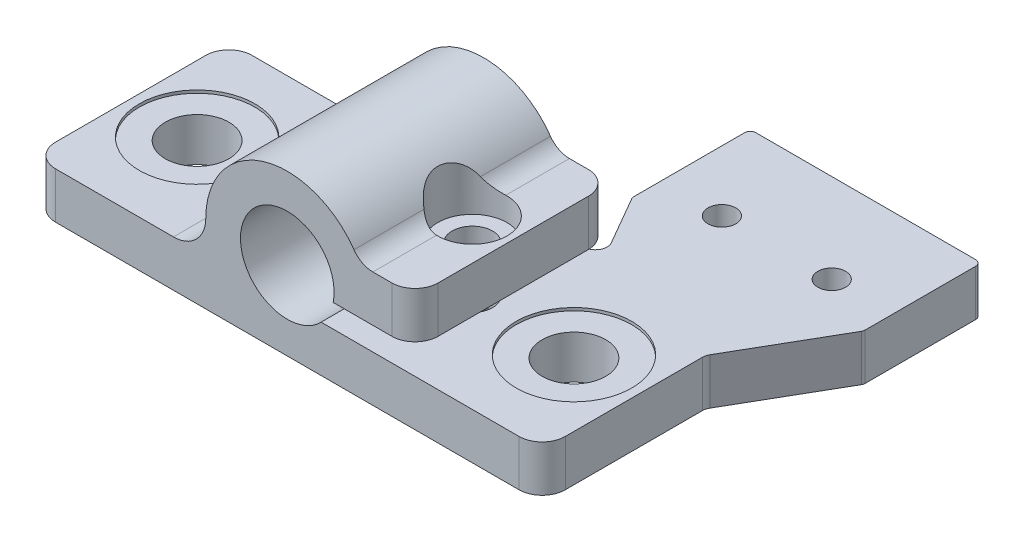
from build123d import *

# Parameters (mm, degrees)
BOSS_EXTRUDE1_DEPTH     = 8.5
CUT_EXTRUDE1_DEPTH      = 2
CUT_EXTRUDE1_DEPTH_BACK = 26.602245995
SKETCH2_R               = 2.75
CUT_EXTRUDE2_DEPTH      = 2
CUT_EXTRUDE2_DEPTH_BACK = 0.25
SKETCH2_3_R             = 5
SKETCH2_3_R_2           = 2.75
SKETCH3_R               = 1.75
CUT_EXTRUDE3_DEPTH      = 28.391148205
SKETCH3_3_R             = 3
SKETCH3_3_R_2           = 1.75
CUT_EXTRUDE4_DEPTH      = 5.85
FILLET1_R               = 2
FILLET2_R               = 2
CUT_EXTRUDE5_DEPTH      = 2
SKETCH5_R               = 1.2
BOSS_EXTRUDE2_DEPTH     = 4
FILLET3_R               = 1
FILLET4_R               = 0.5


with BuildPart() as part:
    # Sketch1 → Boss-Extrude1 (new, symmetric)
    with BuildSketch(Plane.XY):
        with BuildLine():
            Line((11.05, 4), (3.970201506, 4))
            ThreePointArc((3.970201506, 4), (-3.590264914, 6.674165907), (2.926174978, 2))
            Line((2.926174978, 2), (22.05, 2))
            Line((22.05, 2), (22.05, -2))
            Line((22.05, -2), (-22.05, -2))
            Line((-22.05, -2), (-22.05, 2))
            Line((-22.05, 2), (-9.85, 2))
            ThreePointArc((-9.85, 2), (-7.870101013, 2.820101013), (-7.05, 4.8))
            ThreePointArc((-7.05, 4.8), (-1.645444408, 11.655290855), (6.281918497, 8))
            Line((6.281918497, 8), (11.05, 8))
            Line((11.05, 8), (11.05, 4))
        make_face()
    extrude(amount=BOSS_EXTRUDE1_DEPTH, both=True)

    # Sketch2 → Cut-Extrude1 (cut, two sides: drawn at the far end of the back side and taken through both)
    with BuildSketch(Plane(origin=(0, 2, 0), x_dir=(1, 0, 0), z_dir=(0, 1, 0)).offset(-CUT_EXTRUDE1_DEPTH_BACK)):
        with Locations(Location((16.3, 0, 0), (0, 0, 180))):
            Circle(SKETCH2_R)
        with Locations(Location((-16.3, 0, 0), (0, 0, 180))):
            Circle(SKETCH2_R)
    extrude(amount=CUT_EXTRUDE1_DEPTH + CUT_EXTRUDE1_DEPTH_BACK, mode=Mode.SUBTRACT)

    # Sketch2<3> → Cut-Extrude2 (cut, two sides: drawn at the far end of the back side and taken through both)
    # profile 1 of 2: a face of its own
    with BuildSketch(Plane(origin=(0, 2, 0), x_dir=(1, 0, 0), z_dir=(0, 1, 0)).offset(-CUT_EXTRUDE2_DEPTH_BACK)):
        with Locations(Location((16.3, 0, 0), (0, 0, 180))):
            Circle(SKETCH2_3_R)
        with Locations(Location((16.3, 0, 0), (0, 0, 180))):
            Circle(SKETCH2_3_R_2, mode=Mode.SUBTRACT)
    # profile 2 of 2: a face of its own
    with BuildSketch(Plane(origin=(0, 2, 0), x_dir=(1, 0, 0), z_dir=(0, 1, 0)).offset(-CUT_EXTRUDE2_DEPTH_BACK)):
        with Locations(Location((-16.3, 0, 0), (0, 0, 180))):
            Circle(SKETCH2_3_R)
        with Locations(Location((-16.3, 0, 0), (0, 0, 180))):
            Circle(SKETCH2_3_R_2, mode=Mode.SUBTRACT)
    extrude(amount=CUT_EXTRUDE2_DEPTH + CUT_EXTRUDE2_DEPTH_BACK, mode=Mode.SUBTRACT)

    # Sketch3 → Cut-Extrude3 (cut, through all)
    with BuildSketch(Plane(origin=(0, 11.85, 0), x_dir=(1, 0, 0), z_dir=(0, 1, 0))):
        with Locations(Location((7.510100753, 0, 0), (0, 0, 225.426920251))):
            Circle(SKETCH3_R)
    extrude(amount=-CUT_EXTRUDE3_DEPTH, mode=Mode.SUBTRACT)

    # Sketch3<3> → Cut-Extrude4 (cut)
    # profile 1 of 2: a face of its own
    with BuildSketch(Plane(origin=(0, 11.85, 0), x_dir=(1, 0, 0), z_dir=(0, 1, 0))):
        with Locations(Location((7.510100753, 0, 0), (0, 0, 245.83322212))):
            Circle(SKETCH3_3_R)
        with Locations(Location((7.510100753, 0, 0), (0, 0, 180))):
            Circle(SKETCH3_3_R_2, mode=Mode.SUBTRACT)
    # profile 2 of 2: a face of its own
    with BuildSketch(Plane(origin=(0, 11.85, 0), x_dir=(1, 0, 0), z_dir=(0, 1, 0))):
        with Locations(Location((7.510100753, 0, 0), (0, 0, 180))):
            Circle(SKETCH3_3_R_2)
    extrude(amount=-CUT_EXTRUDE4_DEPTH, mode=Mode.SUBTRACT)

    # Fillet1
    fillet1_edges = [part.edges().sort_by_distance(p)[0] for p in [
        (22.05, 0, 8.5),
        (-22.05, 0, -8.5),
        (-22.05, 0, 8.5),
    ]]
    fillet(fillet1_edges, radius=FILLET1_R)

    # Fillet2
    # the kernel refuses this fillet: 2 mm, written as the material it adds along each edge
    with BuildSketch(Plane(origin=(6.281918497, 8, -0.075436901), x_dir=(1, 0, 0), z_dir=(0, 0, 1))) as fillet2_piece_1_section:
        with BuildLine():
            CenterArc((1.125003941, 2), FILLET2_R, 215.07061915, 54.92938085)
            ThreePointArc((-0.511884995, 0.850828729), (-0.240944724, 0.434437491), (0, 0))
            Line((0, 0), (1.125003941, 0))
        make_face()
    fillet2_piece_1 = extrude(amount=8.575436901, mode=Mode.PRIVATE)
    fillet2_piece_1 = fillet2_piece_1 - Plane(origin=(7.510100753, 8.184515376, 0), x_dir=(-0.4093940854484991, 0, 0.9123576507049125), z_dir=(0, 1, 0)) * Cylinder(3, 22, mode=Mode.PRIVATE)
    add(fillet2_piece_1)
    with BuildSketch(Plane(origin=(6.281918497, 8, -8.5), x_dir=(1, 0, 0), z_dir=(0, 0, 1))) as fillet2_piece_2_section:
        with BuildLine():
            CenterArc((1.125003941, 2), FILLET2_R, 215.07061915, 54.92938085)
            ThreePointArc((-0.511884995, 0.850828729), (-0.240944724, 0.434437491), (0, 0))
            Line((0, 0), (1.125003941, 0))
        make_face()
    fillet2_piece_2 = extrude(amount=8.575436901, mode=Mode.PRIVATE)
    fillet2_piece_2 = fillet2_piece_2 - Plane(origin=(7.510100753, 8.184515325, 0), x_dir=(-0.4093940854484991, 0, 0.9123576507049125), z_dir=(0, 1, 0)) * Cylinder(3, 22, mode=Mode.PRIVATE)
    add(fillet2_piece_2)
    # the kernel refuses this fillet: 2 mm, written as the material it takes off along each edge
    with BuildSketch(Plane(origin=(11.05, 13, -8.5), x_dir=(-1, 0, 0), z_dir=(0, -1, 0))) as fillet2_2_piece_1_section:
        with BuildLine():
            CenterArc((FILLET2_R, -FILLET2_R), FILLET2_R, 90, 90)
            Line((0, -FILLET2_R), (0, 0))
            Line((0, 0), (FILLET2_R, 0))
        make_face()
    fillet2_2_piece_1 = extrude(amount=14, mode=Mode.PRIVATE)
    fillet2_2_piece_1 = split(fillet2_2_piece_1, bisect_by=Plane(origin=(10.603264122, 2, -8.053264122), z_dir=(0, 1, 0)), keep=Keep.TOP, mode=Mode.PRIVATE)
    add(fillet2_2_piece_1, mode=Mode.SUBTRACT)
    with BuildSketch(Plane(origin=(11.05, 13, 8.5), x_dir=(-1, 0, 0), z_dir=(0, -1, 0))) as fillet2_2_piece_2_section:
        with BuildLine():
            CenterArc((FILLET2_R, FILLET2_R), FILLET2_R, 180, 90)
            Line((0, FILLET2_R), (0, 0))
            Line((0, 0), (FILLET2_R, 0))
        make_face()
    fillet2_2_piece_2 = extrude(amount=14, mode=Mode.PRIVATE)
    fillet2_2_piece_2 = split(fillet2_2_piece_2, bisect_by=Plane(origin=(10.603264122, 2, 8.053264122), z_dir=(0, 1, 0)), keep=Keep.TOP, mode=Mode.PRIVATE)
    add(fillet2_2_piece_2, mode=Mode.SUBTRACT)

    # Sketch4 → Cut-Extrude5 (cut)
    with BuildSketch(Plane.XZ.offset(2)):
        Polygon((10.772129774, 0), (9.141115264, 2.825), (5.879086243, 2.825), (4.248071732, 0), (5.879086243, -2.825), (9.141115264, -2.825), align=None)
    extrude(amount=-CUT_EXTRUDE5_DEPTH, mode=Mode.SUBTRACT)

    # Sketch5 → Boss-Extrude2 (add)
    with BuildSketch(Plane(origin=(0, 2, 0), x_dir=(1, 0, 0), z_dir=(0, 1, 0))):
        Polygon((27.05, 14.3), (27.05, 24.5), (7.05, 24.5), (7.05, 14.3), (10.398631561, 8.5), (22.05, 8.5), (22.05, 5.639745962), align=None)
        with Locations(Location((21.8, 16.8, 0), (0, 0, 180))):
            Circle(SKETCH5_R, mode=Mode.SUBTRACT)
        with Locations(Location((12.3, 16.8, 0), (0, 0, 180))):
            Circle(SKETCH5_R, mode=Mode.SUBTRACT)
    extrude(amount=-BOSS_EXTRUDE2_DEPTH)

    # Fillet3
    fillet3_edges = [part.edges().sort_by_distance(p)[0] for p in [
        (10.398631561, 0, -8.5),
        (22.05, 0, -5.639745962),
    ]]
    fillet(fillet3_edges, radius=FILLET3_R)

    # Fillet4
    fillet4_edges = [part.edges().sort_by_distance(p)[0] for p in [
        (27.05, 0, -24.5),
        (7.05, 0, -24.5),
        (7.05, 0, -14.3),
        (27.05, 0, -14.3),
    ]]
    fillet(fillet4_edges, radius=FILLET4_R)


solid = part.part
